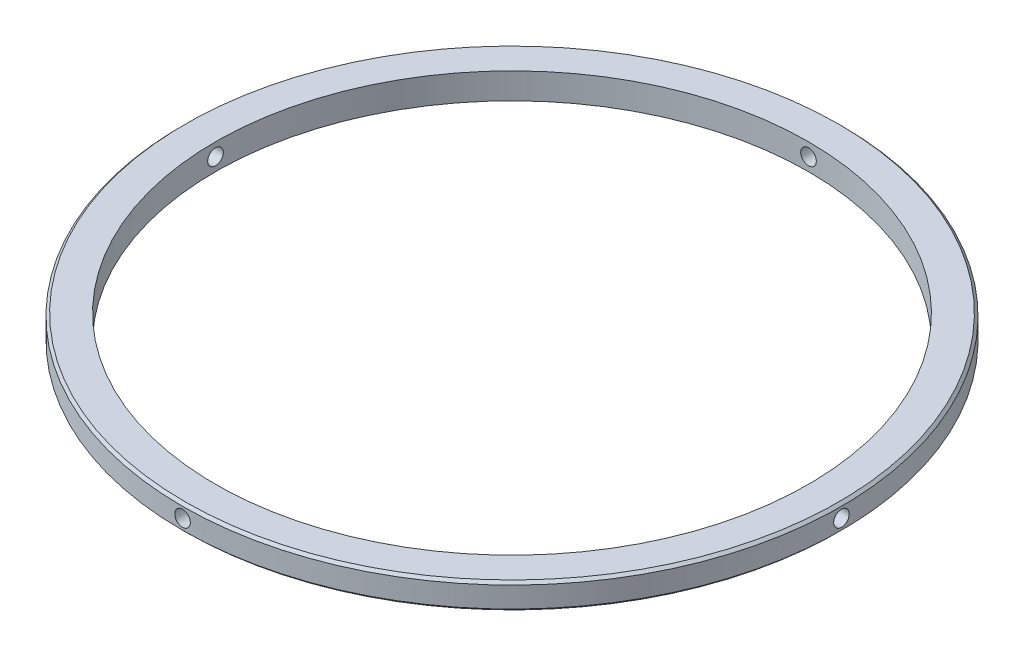
from build123d import *

# Parameters (mm, degrees)
OUTER_RING_MAIN_SKETCH_R   = 63.5
OUTER_RING_MAIN_BODY_DEPTH = 5
CENTER_HOLE_SKETCH_R       = 57.15
CENTER_HOLE_DEPTH          = 90.94164775
PIN_HOLE_DEPTH             = 90.94164775
PIN_HOLE_DEPTH_BACK        = 90.94164775
PIN_HOLE_SKETCH_R          = 1.5
PIN_HOLE_2_DEPTH           = 90.941647902
PIN_HOLE_2_DEPTH_BACK      = 90.941647902
PIN_HOLE_2_SKETCH_R        = 1.5
OUTER_RING_CHAMFER_SIZE    = 0.5


with BuildPart() as part:
    # Outer Ring Main Sketch → Outer Ring Main Body (new body)
    with BuildSketch(Plane(origin=(0, 0, 0), x_dir=(1, 0, 0), z_dir=(0, 1, 0))):
        Circle(OUTER_RING_MAIN_SKETCH_R)
    extrude(amount=OUTER_RING_MAIN_BODY_DEPTH)

    # Center Hole Sketch → Center Hole (cut, through all)
    with BuildSketch(Plane.XZ):
        Circle(CENTER_HOLE_SKETCH_R)
    extrude(amount=-CENTER_HOLE_DEPTH, mode=Mode.SUBTRACT)

    # Pin Hole Sketch → Pin Hole (cut, two sides: drawn at the far end of the back side and taken through both)
    with BuildSketch(Plane.XY.offset(-PIN_HOLE_DEPTH_BACK)):
        with Locations((0, 2.5)):
            Circle(PIN_HOLE_SKETCH_R)
    extrude(amount=PIN_HOLE_DEPTH + PIN_HOLE_DEPTH_BACK, mode=Mode.SUBTRACT)

    # Pin Hole 2 Sketch → Pin Hole 2 (cut, two sides: drawn at the far end of the back side and taken through both)
    with BuildSketch(Plane(origin=(0, 0, 0), x_dir=(0, 0, -1), z_dir=(1, 0, 0)).offset(-PIN_HOLE_2_DEPTH_BACK)):
        with Locations((0, 2.5)):
            Circle(PIN_HOLE_2_SKETCH_R)
    extrude(amount=PIN_HOLE_2_DEPTH + PIN_HOLE_2_DEPTH_BACK, mode=Mode.SUBTRACT)

    # Outer Ring Chamfer
    outer_ring_chamfer_edges = [part.edges().sort_by_distance(p)[0] for p in [
        (-63.5, 5, 0),
        (-63.5, 0, 0),
    ]]
    chamfer(outer_ring_chamfer_edges, length=OUTER_RING_CHAMFER_SIZE)


solid = part.part
